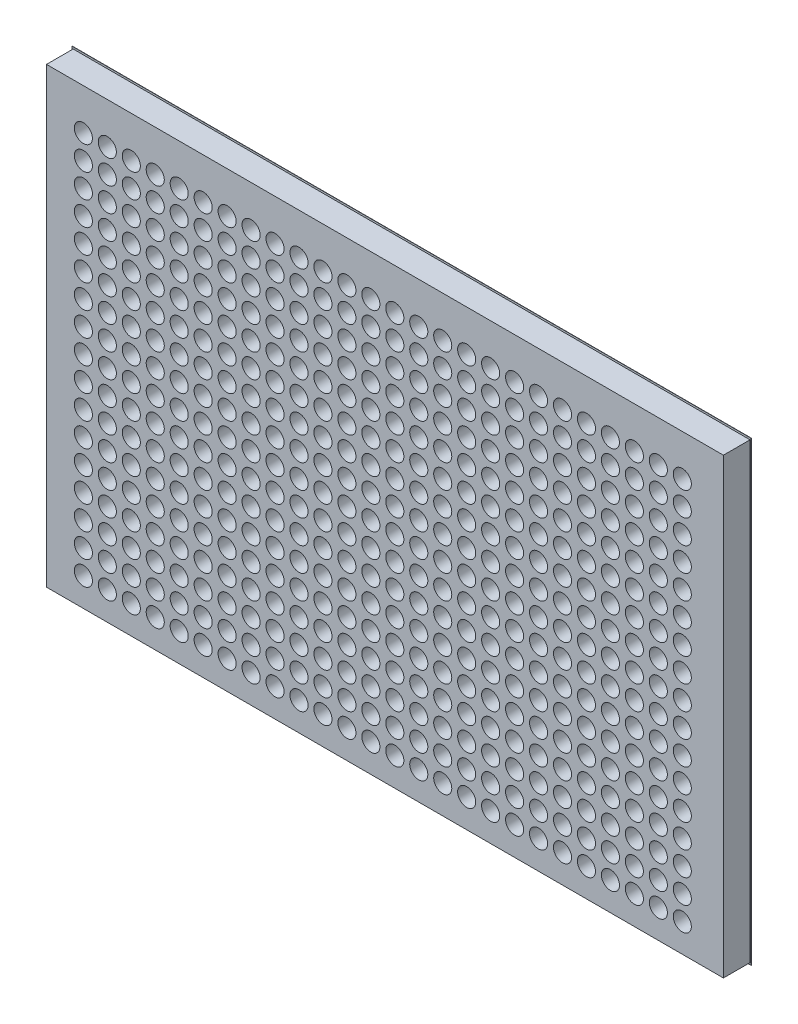
from build123d import *

# Parameters (mm, degrees)
SKETCH2_W           = 255.2
SKETCH2_H           = 171.5
BOSS_EXTRUDE2_DEPTH = 0.1
SKETCH3_W           = 254.3
SKETCH3_H           = 170.1
BOSS_EXTRUDE3_DEPTH = 10
SKETCH4_R           = 3.4
CUT_EXTRUDE2_DEPTH  = 10.1


with BuildPart() as part:
    # Sketch2 → Boss-Extrude2 (new body)
    with BuildSketch(Plane.XY):
        Rectangle(SKETCH2_W, SKETCH2_H)
    extrude(amount=BOSS_EXTRUDE2_DEPTH)

    # Sketch3 → Boss-Extrude3 (add)
    with BuildSketch(Plane.XY.offset(0.1)):
        Rectangle(SKETCH3_W, SKETCH3_H)
    extrude(amount=BOSS_EXTRUDE3_DEPTH)

    # Sketch4 → Cut-Extrude2 (cut)
    with BuildSketch(Plane.XY.offset(10.1)):
        with Locations((-113.3, -74.39)):
            Circle(SKETCH4_R)
        with Locations((-104.3, -74.39)):
            Circle(SKETCH4_R)
        with Locations((-95.3, -74.39)):
            Circle(SKETCH4_R)
        with Locations((-86.3, -74.39)):
            Circle(SKETCH4_R)
        with Locations((-77.3, -74.39)):
            Circle(SKETCH4_R)
        with Locations((-68.3, -74.39)):
            Circle(SKETCH4_R)
        with Locations((-59.3, -74.39)):
            Circle(SKETCH4_R)
        with Locations((-50.3, -74.39)):
            Circle(SKETCH4_R)
        with Locations((-41.3, -74.39)):
            Circle(SKETCH4_R)
        with Locations((-32.3, -74.39)):
            Circle(SKETCH4_R)
        with Locations((-23.3, -74.39)):
            Circle(SKETCH4_R)
        with Locations((-14.3, -74.39)):
            Circle(SKETCH4_R)
        with Locations((-5.3, -74.39)):
            Circle(SKETCH4_R)
        with Locations((3.7, -74.39)):
            Circle(SKETCH4_R)
        with Locations((12.7, -74.39)):
            Circle(SKETCH4_R)
        with Locations((21.7, -74.39)):
            Circle(SKETCH4_R)
        with Locations((30.7, -74.39)):
            Circle(SKETCH4_R)
        with Locations((39.7, -74.39)):
            Circle(SKETCH4_R)
        with Locations((48.7, -74.39)):
            Circle(SKETCH4_R)
        with Locations((57.7, -74.39)):
            Circle(SKETCH4_R)
        with Locations((66.7, -74.39)):
            Circle(SKETCH4_R)
        with Locations((75.7, -74.39)):
            Circle(SKETCH4_R)
        with Locations((84.7, -74.39)):
            Circle(SKETCH4_R)
        with Locations((93.7, -74.39)):
            Circle(SKETCH4_R)
        with Locations((102.7, -74.39)):
            Circle(SKETCH4_R)
        with Locations((111.7, -74.39)):
            Circle(SKETCH4_R)
        with Locations((-104.3, -65.39)):
            Circle(SKETCH4_R)
        with Locations((-95.3, -65.39)):
            Circle(SKETCH4_R)
        with Locations((-86.3, -65.39)):
            Circle(SKETCH4_R)
        with Locations((-77.3, -65.39)):
            Circle(SKETCH4_R)
        with Locations((-68.3, -65.39)):
            Circle(SKETCH4_R)
        with Locations((-59.3, -65.39)):
            Circle(SKETCH4_R)
        with Locations((-50.3, -65.39)):
            Circle(SKETCH4_R)
        with Locations((-41.3, -65.39)):
            Circle(SKETCH4_R)
        with Locations((-32.3, -65.39)):
            Circle(SKETCH4_R)
        with Locations((-23.3, -65.39)):
            Circle(SKETCH4_R)
        with Locations((-14.3, -65.39)):
            Circle(SKETCH4_R)
        with Locations((-5.3, -65.39)):
            Circle(SKETCH4_R)
        with Locations((3.7, -65.39)):
            Circle(SKETCH4_R)
        with Locations((12.7, -65.39)):
            Circle(SKETCH4_R)
        with Locations((21.7, -65.39)):
            Circle(SKETCH4_R)
        with Locations((30.7, -65.39)):
            Circle(SKETCH4_R)
        with Locations((39.7, -65.39)):
            Circle(SKETCH4_R)
        with Locations((48.7, -65.39)):
            Circle(SKETCH4_R)
        with Locations((57.7, -65.39)):
            Circle(SKETCH4_R)
        with Locations((66.7, -65.39)):
            Circle(SKETCH4_R)
        with Locations((75.7, -65.39)):
            Circle(SKETCH4_R)
        with Locations((84.7, -65.39)):
            Circle(SKETCH4_R)
        with Locations((93.7, -65.39)):
            Circle(SKETCH4_R)
        with Locations((102.7, -65.39)):
            Circle(SKETCH4_R)
        with Locations((111.7, -65.39)):
            Circle(SKETCH4_R)
        with Locations((-104.3, -56.39)):
            Circle(SKETCH4_R)
        with Locations((-95.3, -56.39)):
            Circle(SKETCH4_R)
        with Locations((-86.3, -56.39)):
            Circle(SKETCH4_R)
        with Locations((-77.3, -56.39)):
            Circle(SKETCH4_R)
        with Locations((-68.3, -56.39)):
            Circle(SKETCH4_R)
        with Locations((-59.3, -56.39)):
            Circle(SKETCH4_R)
        with Locations((-50.3, -56.39)):
            Circle(SKETCH4_R)
        with Locations((-41.3, -56.39)):
            Circle(SKETCH4_R)
        with Locations((-32.3, -56.39)):
            Circle(SKETCH4_R)
        with Locations((-23.3, -56.39)):
            Circle(SKETCH4_R)
        with Locations((-14.3, -56.39)):
            Circle(SKETCH4_R)
        with Locations((-5.3, -56.39)):
            Circle(SKETCH4_R)
        with Locations((3.7, -56.39)):
            Circle(SKETCH4_R)
        with Locations((12.7, -56.39)):
            Circle(SKETCH4_R)
        with Locations((21.7, -56.39)):
            Circle(SKETCH4_R)
        with Locations((30.7, -56.39)):
            Circle(SKETCH4_R)
        with Locations((39.7, -56.39)):
            Circle(SKETCH4_R)
        with Locations((48.7, -56.39)):
            Circle(SKETCH4_R)
        with Locations((57.7, -56.39)):
            Circle(SKETCH4_R)
        with Locations((66.7, -56.39)):
            Circle(SKETCH4_R)
        with Locations((75.7, -56.39)):
            Circle(SKETCH4_R)
        with Locations((84.7, -56.39)):
            Circle(SKETCH4_R)
        with Locations((93.7, -56.39)):
            Circle(SKETCH4_R)
        with Locations((102.7, -56.39)):
            Circle(SKETCH4_R)
        with Locations((111.7, -56.39)):
            Circle(SKETCH4_R)
        with Locations((-104.3, -47.39)):
            Circle(SKETCH4_R)
        with Locations((-95.3, -47.39)):
            Circle(SKETCH4_R)
        with Locations((-86.3, -47.39)):
            Circle(SKETCH4_R)
        with Locations((-77.3, -47.39)):
            Circle(SKETCH4_R)
        with Locations((-68.3, -47.39)):
            Circle(SKETCH4_R)
        with Locations((-59.3, -47.39)):
            Circle(SKETCH4_R)
        with Locations((-50.3, -47.39)):
            Circle(SKETCH4_R)
        with Locations((-41.3, -47.39)):
            Circle(SKETCH4_R)
        with Locations((-32.3, -47.39)):
            Circle(SKETCH4_R)
        with Locations((-23.3, -47.39)):
            Circle(SKETCH4_R)
        with Locations((-14.3, -47.39)):
            Circle(SKETCH4_R)
        with Locations((-5.3, -47.39)):
            Circle(SKETCH4_R)
        with Locations((3.7, -47.39)):
            Circle(SKETCH4_R)
        with Locations((12.7, -47.39)):
            Circle(SKETCH4_R)
        with Locations((21.7, -47.39)):
            Circle(SKETCH4_R)
        with Locations((30.7, -47.39)):
            Circle(SKETCH4_R)
        with Locations((39.7, -47.39)):
            Circle(SKETCH4_R)
        with Locations((48.7, -47.39)):
            Circle(SKETCH4_R)
        with Locations((57.7, -47.39)):
            Circle(SKETCH4_R)
        with Locations((66.7, -47.39)):
            Circle(SKETCH4_R)
        with Locations((75.7, -47.39)):
            Circle(SKETCH4_R)
        with Locations((84.7, -47.39)):
            Circle(SKETCH4_R)
        with Locations((93.7, -47.39)):
            Circle(SKETCH4_R)
        with Locations((102.7, -47.39)):
            Circle(SKETCH4_R)
        with Locations((111.7, -47.39)):
            Circle(SKETCH4_R)
        with Locations((-104.3, -38.39)):
            Circle(SKETCH4_R)
        with Locations((-95.3, -38.39)):
            Circle(SKETCH4_R)
        with Locations((-86.3, -38.39)):
            Circle(SKETCH4_R)
        with Locations((-77.3, -38.39)):
            Circle(SKETCH4_R)
        with Locations((-68.3, -38.39)):
            Circle(SKETCH4_R)
        with Locations((-59.3, -38.39)):
            Circle(SKETCH4_R)
        with Locations((-50.3, -38.39)):
            Circle(SKETCH4_R)
        with Locations((-41.3, -38.39)):
            Circle(SKETCH4_R)
        with Locations((-32.3, -38.39)):
            Circle(SKETCH4_R)
        with Locations((-23.3, -38.39)):
            Circle(SKETCH4_R)
        with Locations((-14.3, -38.39)):
            Circle(SKETCH4_R)
        with Locations((-5.3, -38.39)):
            Circle(SKETCH4_R)
        with Locations((3.7, -38.39)):
            Circle(SKETCH4_R)
        with Locations((12.7, -38.39)):
            Circle(SKETCH4_R)
        with Locations((21.7, -38.39)):
            Circle(SKETCH4_R)
        with Locations((30.7, -38.39)):
            Circle(SKETCH4_R)
        with Locations((39.7, -38.39)):
            Circle(SKETCH4_R)
        with Locations((48.7, -38.39)):
            Circle(SKETCH4_R)
        with Locations((57.7, -38.39)):
            Circle(SKETCH4_R)
        with Locations((66.7, -38.39)):
            Circle(SKETCH4_R)
        with Locations((75.7, -38.39)):
            Circle(SKETCH4_R)
        with Locations((84.7, -38.39)):
            Circle(SKETCH4_R)
        with Locations((93.7, -38.39)):
            Circle(SKETCH4_R)
        with Locations((102.7, -38.39)):
            Circle(SKETCH4_R)
        with Locations((111.7, -38.39)):
            Circle(SKETCH4_R)
        with Locations((-104.3, -29.39)):
            Circle(SKETCH4_R)
        with Locations((-95.3, -29.39)):
            Circle(SKETCH4_R)
        with Locations((-86.3, -29.39)):
            Circle(SKETCH4_R)
        with Locations((-77.3, -29.39)):
            Circle(SKETCH4_R)
        with Locations((-68.3, -29.39)):
            Circle(SKETCH4_R)
        with Locations((-59.3, -29.39)):
            Circle(SKETCH4_R)
        with Locations((-50.3, -29.39)):
            Circle(SKETCH4_R)
        with Locations((-41.3, -29.39)):
            Circle(SKETCH4_R)
        with Locations((-32.3, -29.39)):
            Circle(SKETCH4_R)
        with Locations((-23.3, -29.39)):
            Circle(SKETCH4_R)
        with Locations((-14.3, -29.39)):
            Circle(SKETCH4_R)
        with Locations((-5.3, -29.39)):
            Circle(SKETCH4_R)
        with Locations((3.7, -29.39)):
            Circle(SKETCH4_R)
        with Locations((12.7, -29.39)):
            Circle(SKETCH4_R)
        with Locations((21.7, -29.39)):
            Circle(SKETCH4_R)
        with Locations((30.7, -29.39)):
            Circle(SKETCH4_R)
        with Locations((39.7, -29.39)):
            Circle(SKETCH4_R)
        with Locations((48.7, -29.39)):
            Circle(SKETCH4_R)
        with Locations((57.7, -29.39)):
            Circle(SKETCH4_R)
        with Locations((66.7, -29.39)):
            Circle(SKETCH4_R)
        with Locations((75.7, -29.39)):
            Circle(SKETCH4_R)
        with Locations((84.7, -29.39)):
            Circle(SKETCH4_R)
        with Locations((93.7, -29.39)):
            Circle(SKETCH4_R)
        with Locations((102.7, -29.39)):
            Circle(SKETCH4_R)
        with Locations((111.7, -29.39)):
            Circle(SKETCH4_R)
        with Locations((-104.3, -20.39)):
            Circle(SKETCH4_R)
        with Locations((-95.3, -20.39)):
            Circle(SKETCH4_R)
        with Locations((-86.3, -20.39)):
            Circle(SKETCH4_R)
        with Locations((-77.3, -20.39)):
            Circle(SKETCH4_R)
        with Locations((-68.3, -20.39)):
            Circle(SKETCH4_R)
        with Locations((-59.3, -20.39)):
            Circle(SKETCH4_R)
        with Locations((-50.3, -20.39)):
            Circle(SKETCH4_R)
        with Locations((-41.3, -20.39)):
            Circle(SKETCH4_R)
        with Locations((-32.3, -20.39)):
            Circle(SKETCH4_R)
        with Locations((-23.3, -20.39)):
            Circle(SKETCH4_R)
        with Locations((-14.3, -20.39)):
            Circle(SKETCH4_R)
        with Locations((-5.3, -20.39)):
            Circle(SKETCH4_R)
        with Locations((3.7, -20.39)):
            Circle(SKETCH4_R)
        with Locations((12.7, -20.39)):
            Circle(SKETCH4_R)
        with Locations((21.7, -20.39)):
            Circle(SKETCH4_R)
        with Locations((30.7, -20.39)):
            Circle(SKETCH4_R)
        with Locations((39.7, -20.39)):
            Circle(SKETCH4_R)
        with Locations((48.7, -20.39)):
            Circle(SKETCH4_R)
        with Locations((57.7, -20.39)):
            Circle(SKETCH4_R)
        with Locations((66.7, -20.39)):
            Circle(SKETCH4_R)
        with Locations((75.7, -20.39)):
            Circle(SKETCH4_R)
        with Locations((84.7, -20.39)):
            Circle(SKETCH4_R)
        with Locations((93.7, -20.39)):
            Circle(SKETCH4_R)
        with Locations((102.7, -20.39)):
            Circle(SKETCH4_R)
        with Locations((111.7, -20.39)):
            Circle(SKETCH4_R)
        with Locations((-104.3, -11.39)):
            Circle(SKETCH4_R)
        with Locations((-95.3, -11.39)):
            Circle(SKETCH4_R)
        with Locations((-86.3, -11.39)):
            Circle(SKETCH4_R)
        with Locations((-77.3, -11.39)):
            Circle(SKETCH4_R)
        with Locations((-68.3, -11.39)):
            Circle(SKETCH4_R)
        with Locations((-59.3, -11.39)):
            Circle(SKETCH4_R)
        with Locations((-50.3, -11.39)):
            Circle(SKETCH4_R)
        with Locations((-41.3, -11.39)):
            Circle(SKETCH4_R)
        with Locations((-32.3, -11.39)):
            Circle(SKETCH4_R)
        with Locations((-23.3, -11.39)):
            Circle(SKETCH4_R)
        with Locations((-14.3, -11.39)):
            Circle(SKETCH4_R)
        with Locations((-5.3, -11.39)):
            Circle(SKETCH4_R)
        with Locations((3.7, -11.39)):
            Circle(SKETCH4_R)
        with Locations((12.7, -11.39)):
            Circle(SKETCH4_R)
        with Locations((21.7, -11.39)):
            Circle(SKETCH4_R)
        with Locations((30.7, -11.39)):
            Circle(SKETCH4_R)
        with Locations((39.7, -11.39)):
            Circle(SKETCH4_R)
        with Locations((48.7, -11.39)):
            Circle(SKETCH4_R)
        with Locations((57.7, -11.39)):
            Circle(SKETCH4_R)
        with Locations((66.7, -11.39)):
            Circle(SKETCH4_R)
        with Locations((75.7, -11.39)):
            Circle(SKETCH4_R)
        with Locations((84.7, -11.39)):
            Circle(SKETCH4_R)
        with Locations((93.7, -11.39)):
            Circle(SKETCH4_R)
        with Locations((102.7, -11.39)):
            Circle(SKETCH4_R)
        with Locations((111.7, -11.39)):
            Circle(SKETCH4_R)
        with Locations((-104.3, -2.39)):
            Circle(SKETCH4_R)
        with Locations((-95.3, -2.39)):
            Circle(SKETCH4_R)
        with Locations((-86.3, -2.39)):
            Circle(SKETCH4_R)
        with Locations((-77.3, -2.39)):
            Circle(SKETCH4_R)
        with Locations((-68.3, -2.39)):
            Circle(SKETCH4_R)
        with Locations((-59.3, -2.39)):
            Circle(SKETCH4_R)
        with Locations((-50.3, -2.39)):
            Circle(SKETCH4_R)
        with Locations((-41.3, -2.39)):
            Circle(SKETCH4_R)
        with Locations((-32.3, -2.39)):
            Circle(SKETCH4_R)
        with Locations((-23.3, -2.39)):
            Circle(SKETCH4_R)
        with Locations((-14.3, -2.39)):
            Circle(SKETCH4_R)
        with Locations((-5.3, -2.39)):
            Circle(SKETCH4_R)
        with Locations((3.7, -2.39)):
            Circle(SKETCH4_R)
        with Locations((12.7, -2.39)):
            Circle(SKETCH4_R)
        with Locations((21.7, -2.39)):
            Circle(SKETCH4_R)
        with Locations((30.7, -2.39)):
            Circle(SKETCH4_R)
        with Locations((39.7, -2.39)):
            Circle(SKETCH4_R)
        with Locations((48.7, -2.39)):
            Circle(SKETCH4_R)
        with Locations((57.7, -2.39)):
            Circle(SKETCH4_R)
        with Locations((66.7, -2.39)):
            Circle(SKETCH4_R)
        with Locations((75.7, -2.39)):
            Circle(SKETCH4_R)
        with Locations((84.7, -2.39)):
            Circle(SKETCH4_R)
        with Locations((93.7, -2.39)):
            Circle(SKETCH4_R)
        with Locations((102.7, -2.39)):
            Circle(SKETCH4_R)
        with Locations((111.7, -2.39)):
            Circle(SKETCH4_R)
        with Locations((-104.3, 6.61)):
            Circle(SKETCH4_R)
        with Locations((-95.3, 6.61)):
            Circle(SKETCH4_R)
        with Locations((-86.3, 6.61)):
            Circle(SKETCH4_R)
        with Locations((-77.3, 6.61)):
            Circle(SKETCH4_R)
        with Locations((-68.3, 6.61)):
            Circle(SKETCH4_R)
        with Locations((-59.3, 6.61)):
            Circle(SKETCH4_R)
        with Locations((-50.3, 6.61)):
            Circle(SKETCH4_R)
        with Locations((-41.3, 6.61)):
            Circle(SKETCH4_R)
        with Locations((-32.3, 6.61)):
            Circle(SKETCH4_R)
        with Locations((-23.3, 6.61)):
            Circle(SKETCH4_R)
        with Locations((-14.3, 6.61)):
            Circle(SKETCH4_R)
        with Locations((-5.3, 6.61)):
            Circle(SKETCH4_R)
        with Locations((3.7, 6.61)):
            Circle(SKETCH4_R)
        with Locations((12.7, 6.61)):
            Circle(SKETCH4_R)
        with Locations((21.7, 6.61)):
            Circle(SKETCH4_R)
        with Locations((30.7, 6.61)):
            Circle(SKETCH4_R)
        with Locations((39.7, 6.61)):
            Circle(SKETCH4_R)
        with Locations((48.7, 6.61)):
            Circle(SKETCH4_R)
        with Locations((57.7, 6.61)):
            Circle(SKETCH4_R)
        with Locations((66.7, 6.61)):
            Circle(SKETCH4_R)
        with Locations((75.7, 6.61)):
            Circle(SKETCH4_R)
        with Locations((84.7, 6.61)):
            Circle(SKETCH4_R)
        with Locations((93.7, 6.61)):
            Circle(SKETCH4_R)
        with Locations((102.7, 6.61)):
            Circle(SKETCH4_R)
        with Locations((111.7, 6.61)):
            Circle(SKETCH4_R)
        with Locations((-104.3, 15.61)):
            Circle(SKETCH4_R)
        with Locations((-95.3, 15.61)):
            Circle(SKETCH4_R)
        with Locations((-86.3, 15.61)):
            Circle(SKETCH4_R)
        with Locations((-77.3, 15.61)):
            Circle(SKETCH4_R)
        with Locations((-68.3, 15.61)):
            Circle(SKETCH4_R)
        with Locations((-59.3, 15.61)):
            Circle(SKETCH4_R)
        with Locations((-50.3, 15.61)):
            Circle(SKETCH4_R)
        with Locations((-41.3, 15.61)):
            Circle(SKETCH4_R)
        with Locations((-32.3, 15.61)):
            Circle(SKETCH4_R)
        with Locations((-23.3, 15.61)):
            Circle(SKETCH4_R)
        with Locations((-14.3, 15.61)):
            Circle(SKETCH4_R)
        with Locations((-5.3, 15.61)):
            Circle(SKETCH4_R)
        with Locations((3.7, 15.61)):
            Circle(SKETCH4_R)
        with Locations((12.7, 15.61)):
            Circle(SKETCH4_R)
        with Locations((21.7, 15.61)):
            Circle(SKETCH4_R)
        with Locations((30.7, 15.61)):
            Circle(SKETCH4_R)
        with Locations((39.7, 15.61)):
            Circle(SKETCH4_R)
        with Locations((48.7, 15.61)):
            Circle(SKETCH4_R)
        with Locations((57.7, 15.61)):
            Circle(SKETCH4_R)
        with Locations((66.7, 15.61)):
            Circle(SKETCH4_R)
        with Locations((75.7, 15.61)):
            Circle(SKETCH4_R)
        with Locations((84.7, 15.61)):
            Circle(SKETCH4_R)
        with Locations((93.7, 15.61)):
            Circle(SKETCH4_R)
        with Locations((102.7, 15.61)):
            Circle(SKETCH4_R)
        with Locations((111.7, 15.61)):
            Circle(SKETCH4_R)
        with Locations((-104.3, 24.61)):
            Circle(SKETCH4_R)
        with Locations((-95.3, 24.61)):
            Circle(SKETCH4_R)
        with Locations((-86.3, 24.61)):
            Circle(SKETCH4_R)
        with Locations((-77.3, 24.61)):
            Circle(SKETCH4_R)
        with Locations((-68.3, 24.61)):
            Circle(SKETCH4_R)
        with Locations((-59.3, 24.61)):
            Circle(SKETCH4_R)
        with Locations((-50.3, 24.61)):
            Circle(SKETCH4_R)
        with Locations((-41.3, 24.61)):
            Circle(SKETCH4_R)
        with Locations((-32.3, 24.61)):
            Circle(SKETCH4_R)
        with Locations((-23.3, 24.61)):
            Circle(SKETCH4_R)
        with Locations((-14.3, 24.61)):
            Circle(SKETCH4_R)
        with Locations((-5.3, 24.61)):
            Circle(SKETCH4_R)
        with Locations((3.7, 24.61)):
            Circle(SKETCH4_R)
        with Locations((12.7, 24.61)):
            Circle(SKETCH4_R)
        with Locations((21.7, 24.61)):
            Circle(SKETCH4_R)
        with Locations((30.7, 24.61)):
            Circle(SKETCH4_R)
        with Locations((39.7, 24.61)):
            Circle(SKETCH4_R)
        with Locations((48.7, 24.61)):
            Circle(SKETCH4_R)
        with Locations((57.7, 24.61)):
            Circle(SKETCH4_R)
        with Locations((66.7, 24.61)):
            Circle(SKETCH4_R)
        with Locations((75.7, 24.61)):
            Circle(SKETCH4_R)
        with Locations((84.7, 24.61)):
            Circle(SKETCH4_R)
        with Locations((93.7, 24.61)):
            Circle(SKETCH4_R)
        with Locations((102.7, 24.61)):
            Circle(SKETCH4_R)
        with Locations((111.7, 24.61)):
            Circle(SKETCH4_R)
        with Locations((-104.3, 33.61)):
            Circle(SKETCH4_R)
        with Locations((-95.3, 33.61)):
            Circle(SKETCH4_R)
        with Locations((-86.3, 33.61)):
            Circle(SKETCH4_R)
        with Locations((-77.3, 33.61)):
            Circle(SKETCH4_R)
        with Locations((-68.3, 33.61)):
            Circle(SKETCH4_R)
        with Locations((-59.3, 33.61)):
            Circle(SKETCH4_R)
        with Locations((-50.3, 33.61)):
            Circle(SKETCH4_R)
        with Locations((-41.3, 33.61)):
            Circle(SKETCH4_R)
        with Locations((-32.3, 33.61)):
            Circle(SKETCH4_R)
        with Locations((-23.3, 33.61)):
            Circle(SKETCH4_R)
        with Locations((-14.3, 33.61)):
            Circle(SKETCH4_R)
        with Locations((-5.3, 33.61)):
            Circle(SKETCH4_R)
        with Locations((3.7, 33.61)):
            Circle(SKETCH4_R)
        with Locations((12.7, 33.61)):
            Circle(SKETCH4_R)
        with Locations((21.7, 33.61)):
            Circle(SKETCH4_R)
        with Locations((30.7, 33.61)):
            Circle(SKETCH4_R)
        with Locations((39.7, 33.61)):
            Circle(SKETCH4_R)
        with Locations((48.7, 33.61)):
            Circle(SKETCH4_R)
        with Locations((57.7, 33.61)):
            Circle(SKETCH4_R)
        with Locations((66.7, 33.61)):
            Circle(SKETCH4_R)
        with Locations((75.7, 33.61)):
            Circle(SKETCH4_R)
        with Locations((84.7, 33.61)):
            Circle(SKETCH4_R)
        with Locations((93.7, 33.61)):
            Circle(SKETCH4_R)
        with Locations((102.7, 33.61)):
            Circle(SKETCH4_R)
        with Locations((111.7, 33.61)):
            Circle(SKETCH4_R)
        with Locations((-104.3, 42.61)):
            Circle(SKETCH4_R)
        with Locations((-95.3, 42.61)):
            Circle(SKETCH4_R)
        with Locations((-86.3, 42.61)):
            Circle(SKETCH4_R)
        with Locations((-77.3, 42.61)):
            Circle(SKETCH4_R)
        with Locations((-68.3, 42.61)):
            Circle(SKETCH4_R)
        with Locations((-59.3, 42.61)):
            Circle(SKETCH4_R)
        with Locations((-50.3, 42.61)):
            Circle(SKETCH4_R)
        with Locations((-41.3, 42.61)):
            Circle(SKETCH4_R)
        with Locations((-32.3, 42.61)):
            Circle(SKETCH4_R)
        with Locations((-23.3, 42.61)):
            Circle(SKETCH4_R)
        with Locations((-14.3, 42.61)):
            Circle(SKETCH4_R)
        with Locations((-5.3, 42.61)):
            Circle(SKETCH4_R)
        with Locations((3.7, 42.61)):
            Circle(SKETCH4_R)
        with Locations((12.7, 42.61)):
            Circle(SKETCH4_R)
        with Locations((21.7, 42.61)):
            Circle(SKETCH4_R)
        with Locations((30.7, 42.61)):
            Circle(SKETCH4_R)
        with Locations((39.7, 42.61)):
            Circle(SKETCH4_R)
        with Locations((48.7, 42.61)):
            Circle(SKETCH4_R)
        with Locations((57.7, 42.61)):
            Circle(SKETCH4_R)
        with Locations((66.7, 42.61)):
            Circle(SKETCH4_R)
        with Locations((75.7, 42.61)):
            Circle(SKETCH4_R)
        with Locations((84.7, 42.61)):
            Circle(SKETCH4_R)
        with Locations((93.7, 42.61)):
            Circle(SKETCH4_R)
        with Locations((102.7, 42.61)):
            Circle(SKETCH4_R)
        with Locations((111.7, 42.61)):
            Circle(SKETCH4_R)
        with Locations((-104.3, 51.61)):
            Circle(SKETCH4_R)
        with Locations((-95.3, 51.61)):
            Circle(SKETCH4_R)
        with Locations((-86.3, 51.61)):
            Circle(SKETCH4_R)
        with Locations((-77.3, 51.61)):
            Circle(SKETCH4_R)
        with Locations((-68.3, 51.61)):
            Circle(SKETCH4_R)
        with Locations((-59.3, 51.61)):
            Circle(SKETCH4_R)
        with Locations((-50.3, 51.61)):
            Circle(SKETCH4_R)
        with Locations((-41.3, 51.61)):
            Circle(SKETCH4_R)
        with Locations((-32.3, 51.61)):
            Circle(SKETCH4_R)
        with Locations((-23.3, 51.61)):
            Circle(SKETCH4_R)
        with Locations((-14.3, 51.61)):
            Circle(SKETCH4_R)
        with Locations((-5.3, 51.61)):
            Circle(SKETCH4_R)
        with Locations((3.7, 51.61)):
            Circle(SKETCH4_R)
        with Locations((12.7, 51.61)):
            Circle(SKETCH4_R)
        with Locations((21.7, 51.61)):
            Circle(SKETCH4_R)
        with Locations((30.7, 51.61)):
            Circle(SKETCH4_R)
        with Locations((39.7, 51.61)):
            Circle(SKETCH4_R)
        with Locations((48.7, 51.61)):
            Circle(SKETCH4_R)
        with Locations((57.7, 51.61)):
            Circle(SKETCH4_R)
        with Locations((66.7, 51.61)):
            Circle(SKETCH4_R)
        with Locations((75.7, 51.61)):
            Circle(SKETCH4_R)
        with Locations((84.7, 51.61)):
            Circle(SKETCH4_R)
        with Locations((93.7, 51.61)):
            Circle(SKETCH4_R)
        with Locations((102.7, 51.61)):
            Circle(SKETCH4_R)
        with Locations((111.7, 51.61)):
            Circle(SKETCH4_R)
        with Locations((-104.3, 60.61)):
            Circle(SKETCH4_R)
        with Locations((-95.3, 60.61)):
            Circle(SKETCH4_R)
        with Locations((-86.3, 60.61)):
            Circle(SKETCH4_R)
        with Locations((-77.3, 60.61)):
            Circle(SKETCH4_R)
        with Locations((-68.3, 60.61)):
            Circle(SKETCH4_R)
        with Locations((-59.3, 60.61)):
            Circle(SKETCH4_R)
        with Locations((-50.3, 60.61)):
            Circle(SKETCH4_R)
        with Locations((-41.3, 60.61)):
            Circle(SKETCH4_R)
        with Locations((-32.3, 60.61)):
            Circle(SKETCH4_R)
        with Locations((-23.3, 60.61)):
            Circle(SKETCH4_R)
        with Locations((-14.3, 60.61)):
            Circle(SKETCH4_R)
        with Locations((-5.3, 60.61)):
            Circle(SKETCH4_R)
        with Locations((3.7, 60.61)):
            Circle(SKETCH4_R)
        with Locations((12.7, 60.61)):
            Circle(SKETCH4_R)
        with Locations((21.7, 60.61)):
            Circle(SKETCH4_R)
        with Locations((30.7, 60.61)):
            Circle(SKETCH4_R)
        with Locations((39.7, 60.61)):
            Circle(SKETCH4_R)
        with Locations((48.7, 60.61)):
            Circle(SKETCH4_R)
        with Locations((57.7, 60.61)):
            Circle(SKETCH4_R)
        with Locations((66.7, 60.61)):
            Circle(SKETCH4_R)
        with Locations((75.7, 60.61)):
            Circle(SKETCH4_R)
        with Locations((84.7, 60.61)):
            Circle(SKETCH4_R)
        with Locations((93.7, 60.61)):
            Circle(SKETCH4_R)
        with Locations((102.7, 60.61)):
            Circle(SKETCH4_R)
        with Locations((111.7, 60.61)):
            Circle(SKETCH4_R)
        with Locations((-104.3, 69.61)):
            Circle(SKETCH4_R)
        with Locations((-95.3, 69.61)):
            Circle(SKETCH4_R)
        with Locations((-86.3, 69.61)):
            Circle(SKETCH4_R)
        with Locations((-77.3, 69.61)):
            Circle(SKETCH4_R)
        with Locations((-68.3, 69.61)):
            Circle(SKETCH4_R)
        with Locations((-59.3, 69.61)):
            Circle(SKETCH4_R)
        with Locations((-50.3, 69.61)):
            Circle(SKETCH4_R)
        with Locations((-41.3, 69.61)):
            Circle(SKETCH4_R)
        with Locations((-32.3, 69.61)):
            Circle(SKETCH4_R)
        with Locations((-23.3, 69.61)):
            Circle(SKETCH4_R)
        with Locations((-14.3, 69.61)):
            Circle(SKETCH4_R)
        with Locations((-5.3, 69.61)):
            Circle(SKETCH4_R)
        with Locations((3.7, 69.61)):
            Circle(SKETCH4_R)
        with Locations((12.7, 69.61)):
            Circle(SKETCH4_R)
        with Locations((21.7, 69.61)):
            Circle(SKETCH4_R)
        with Locations((30.7, 69.61)):
            Circle(SKETCH4_R)
        with Locations((39.7, 69.61)):
            Circle(SKETCH4_R)
        with Locations((48.7, 69.61)):
            Circle(SKETCH4_R)
        with Locations((57.7, 69.61)):
            Circle(SKETCH4_R)
        with Locations((66.7, 69.61)):
            Circle(SKETCH4_R)
        with Locations((75.7, 69.61)):
            Circle(SKETCH4_R)
        with Locations((84.7, 69.61)):
            Circle(SKETCH4_R)
        with Locations((93.7, 69.61)):
            Circle(SKETCH4_R)
        with Locations((102.7, 69.61)):
            Circle(SKETCH4_R)
        with Locations((111.7, 69.61)):
            Circle(SKETCH4_R)
        with Locations((-113.3, -65.39)):
            Circle(SKETCH4_R)
        with Locations((-113.3, -56.39)):
            Circle(SKETCH4_R)
        with Locations((-113.3, -47.39)):
            Circle(SKETCH4_R)
        with Locations((-113.3, -38.39)):
            Circle(SKETCH4_R)
        with Locations((-113.3, -29.39)):
            Circle(SKETCH4_R)
        with Locations((-113.3, -20.39)):
            Circle(SKETCH4_R)
        with Locations((-113.3, -11.39)):
            Circle(SKETCH4_R)
        with Locations((-113.3, -2.39)):
            Circle(SKETCH4_R)
        with Locations((-113.3, 6.61)):
            Circle(SKETCH4_R)
        with Locations((-113.3, 15.61)):
            Circle(SKETCH4_R)
        with Locations((-113.3, 24.61)):
            Circle(SKETCH4_R)
        with Locations((-113.3, 33.61)):
            Circle(SKETCH4_R)
        with Locations((-113.3, 42.61)):
            Circle(SKETCH4_R)
        with Locations((-113.3, 51.61)):
            Circle(SKETCH4_R)
        with Locations((-113.3, 60.61)):
            Circle(SKETCH4_R)
        with Locations((-113.3, 69.61)):
            Circle(SKETCH4_R)
    extrude(amount=-CUT_EXTRUDE2_DEPTH, mode=Mode.SUBTRACT)


solid = part.part
